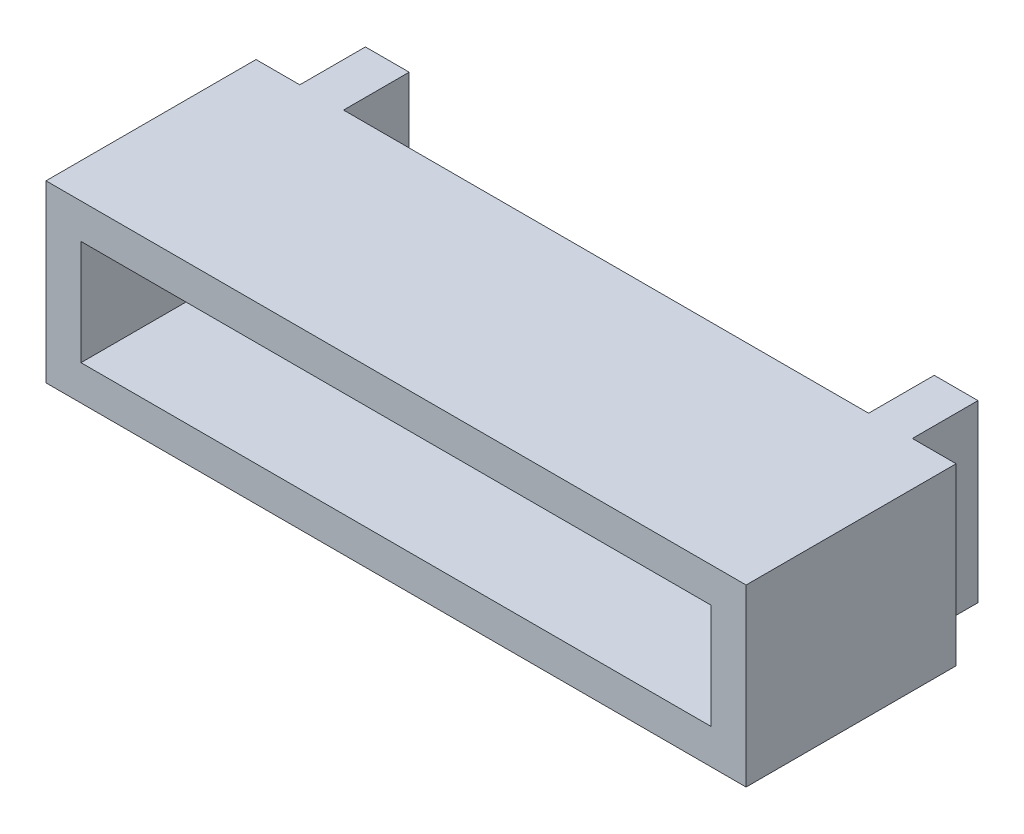
from build123d import *

# Parameters (mm, degrees)
BOSS_EXTRUDE1_DEPTH = 8
SKETCH2_R           = 2.4
BOSS_EXTRUDE2_DEPTH = 1.6
SHELL1_START        = -8
SHELL1_OUTLINE_W    = 28.8
SHELL1_OUTLINE_H    = 4.8
SHELL1_DEPTH        = 8
SHELL1_START_2      = -9.6
SHELL1_2_OUTLINE_R  = 0.8
SHELL1_2_DEPTH      = 1.6


# Read off the part's stored shape, not the designer's step: Shell1
with BuildPart() as part:
    # Sketch1 → Boss-Extrude1 (new body)
    with BuildSketch(Plane(origin=(0, 0, 0), x_dir=(1, 0, 0), z_dir=(0, 1, 0))):
        Polygon((-16, 0), (16, 0), (16, 9.6), (14, 9.6), (14, 12.6), (12, 12.6), (12, 9.6), (-12, 9.6), (-12, 12.6), (-14, 12.6), (-14, 9.6), (-16, 9.6), align=None)
    extrude(amount=BOSS_EXTRUDE1_DEPTH)

    # Sketch2 → Boss-Extrude2 (add)
    with BuildSketch(Plane(origin=(0, 0, -9.6), x_dir=(-1, 0, 0), z_dir=(0, 0, -1))):
        with Locations(Location((4, 4, 0), (0, 0, 180))):
            Circle(SKETCH2_R)
        with Locations(Location((-4, 4, 0), (0, 0, 180))):
            Circle(SKETCH2_R)
    extrude(amount=BOSS_EXTRUDE2_DEPTH)

    # Shell1 outline → Shell1 (cut)
    with BuildSketch(Plane.XY.offset(SHELL1_START)):
        with Locations((0, 4)):
            Rectangle(SHELL1_OUTLINE_W, SHELL1_OUTLINE_H)
    extrude(amount=SHELL1_DEPTH, mode=Mode.SUBTRACT)

    # Shell1 2 outline → Shell1 2 (cut)
    with BuildSketch(Plane.XY.offset(SHELL1_START_2)):
        with Locations((-4, 4)):
            Circle(SHELL1_2_OUTLINE_R)
        with Locations((4, 4)):
            Circle(SHELL1_2_OUTLINE_R)
    extrude(amount=SHELL1_2_DEPTH, mode=Mode.SUBTRACT)


solid = part.part
